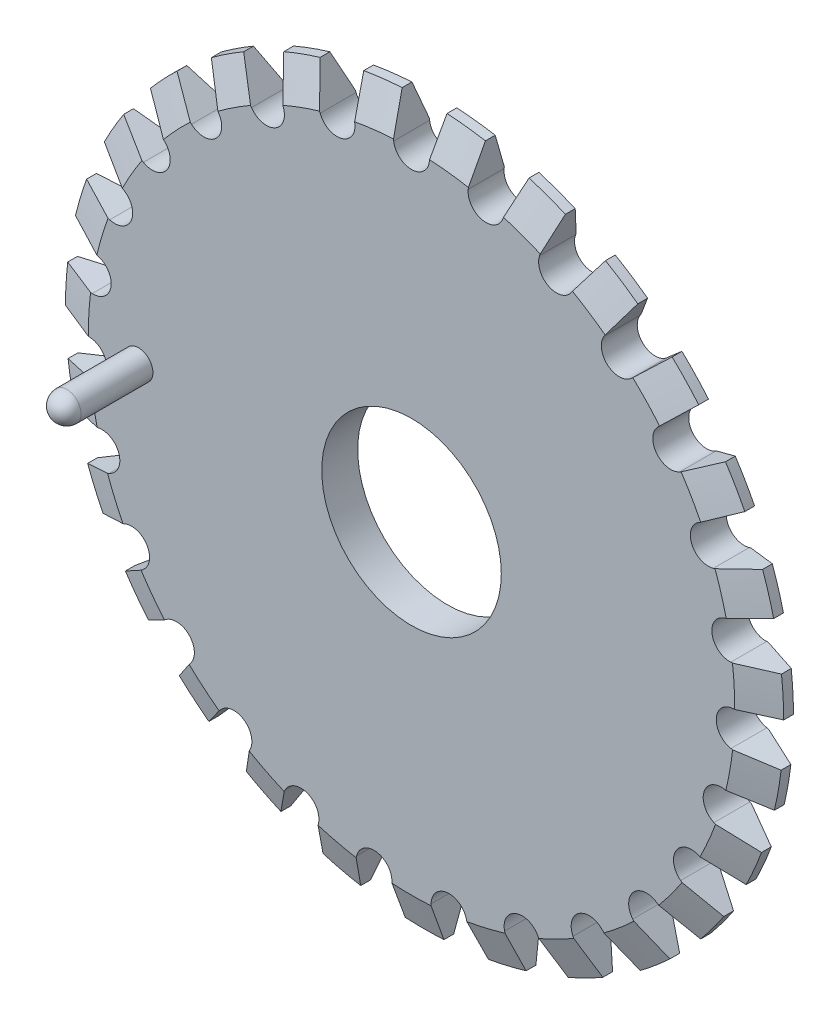
from build123d import *

# Parameters (mm, degrees)
SKETCH1_R           = 100
SKETCH1_R_2         = 25
BOSS_EXTRUDE1_DEPTH = 10
CHAMFER1_SIZE       = 10
CHAMFER1_SIZE2      = 3.639702343
CHAMFER2_SIZE       = 10
CHAMFER2_SIZE2      = 3.639702343
CUT_EXTRUDE1_DEPTH  = 142.774468788
CIRPATTERN1_COUNT   = 27
SKETCH4_R           = 4
BOSS_EXTRUDE2_DEPTH = 20


# Read off the part's stored shape, not the designer's step: Dome1
with BuildPart() as part:
    # Sketch1 → Boss-Extrude1 (new body)
    with BuildSketch(Plane.XY):
        Circle(SKETCH1_R)
        Circle(SKETCH1_R_2, mode=Mode.SUBTRACT)
    extrude(amount=BOSS_EXTRUDE1_DEPTH)

    # Chamfer1
    chamfer1_edges = [part.edges().sort_by_distance(p)[0] for p in [
        (-100, 0, 10),
    ]]
    chamfer1_side = [part.faces().sort_by_distance(p)[0] for p in [
        (-97.171572875, 0, 10),
    ]]
    chamfer(chamfer1_edges, length=CHAMFER1_SIZE, length2=CHAMFER1_SIZE2, reference=chamfer1_side[0])

    # Chamfer2
    chamfer2_edges = [part.edges().sort_by_distance(p)[0] for p in [
        (-100, 0, 0),
    ]]
    chamfer2_side = [part.faces().sort_by_distance(p)[0] for p in [
        (-97.171572875, 0, 0),
    ]]
    chamfer(chamfer2_edges, length=CHAMFER2_SIZE, length2=CHAMFER2_SIZE2, reference=chamfer2_side[0])

    # Sketch3 → Cut-Extrude1 (cut, through all)
    with BuildSketch(Plane.XY.offset(10)):
        with BuildLine():
            Line((4.962730758, 89.390653283), (6.241455565, 99.805031098))
            ThreePointArc((6.241455565, 99.805031098), (0, 100), (-6.241455565, 99.805031098))
            Line((-6.241455565, 99.805031098), (-4.962730758, 89.390653283))
            ThreePointArc((-4.962730758, 89.390653283), (0, 85), (4.962730758, 89.390653283))
        make_face()
    cut_extrude1 = extrude(amount=-CUT_EXTRUDE1_DEPTH, mode=Mode.SUBTRACT)

    # CirPattern1: Cut-Extrude1 ×27 about axis
    cirpattern1_axis = Axis((0, 0, 0), (0, 0, 1))
    for i in range(1, CIRPATTERN1_COUNT):
        add(cut_extrude1.rotate(cirpattern1_axis, i * 360 / CIRPATTERN1_COUNT), mode=Mode.SUBTRACT)

    # Sketch4 → Boss-Extrude2 (add)
    with BuildSketch(Plane.XY.offset(10)):
        with Locations((-76, 0)):
            Circle(SKETCH4_R)
    extrude(amount=BOSS_EXTRUDE2_DEPTH)

    # Dome1 outline → Dome1 (revolve)
    with BuildSketch(Plane(origin=(-76, 0, 0), x_dir=(1, 0, 0), z_dir=(0, -1, 0))):
        with BuildLine():
            Line((0, 30), (4, 29.999999996))
            ThreePointArc((4, 29.999999996), (2.828427126, 32.828427123), (0, 34))
            Line((0, 34), (0, 30))
        make_face()
    revolve(axis=Axis((-76, 0, 0), (0, 0, 1)))


solid = part.part
